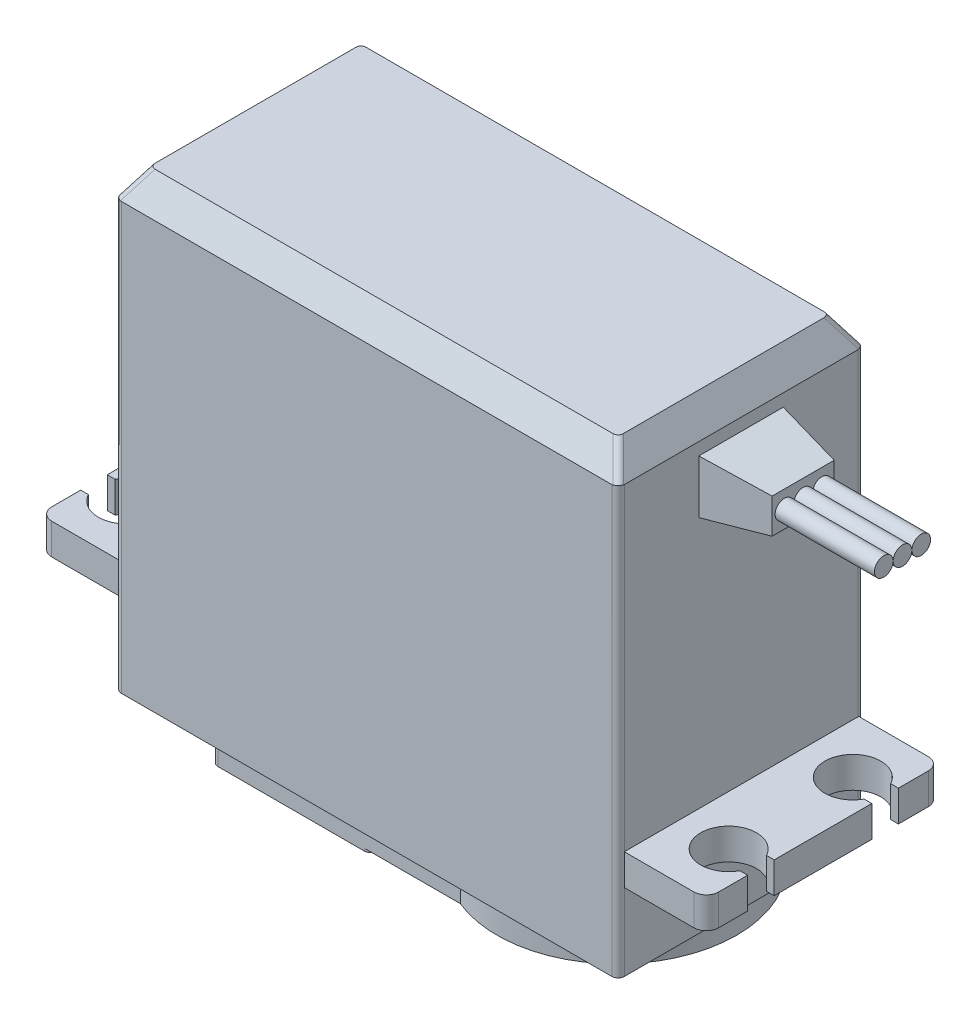
from build123d import *
from OCP.BRepFilletAPI import BRepFilletAPI_MakeChamfer

# Parameters (mm, degrees)
SKETCH_1_W       = 40.5
SKETCH_1_H       = 19.8
BODY_DEPTH       = 36.5
CHAMFER_1_SIZE   = 2.2
CHAMFER_1_SIZE2  = 1.4
FILLET_1_R       = 0.5
MOUNT_DEPTH      = 2.5
FILLET_3_R       = 1
EXTRUDE_3_DEPTH  = 0.5
EXTRUDE_4_DEPTH  = 2
SKETCH_5_W       = 10.8
SKETCH_5_H       = 15.84
EXTRUDE_5_DEPTH  = 0.2
SKETCH_6_R       = 6.6
EXTRUDE_6_DEPTH  = 1.2
SKETCH_7_R       = 5.35
EXTRUDE_7_DEPTH  = 0.5
SKETCH_8_R       = 2.6
SHAFT_HOLE_DEPTH = 10
FILLET_2_R       = 0.5
SKETCH_11_R      = 0.75
EXTRUDE_10_DEPTH = 8


with BuildPart() as part:
    # Эскиз1 → Body (new body)
    with BuildSketch(Plane(origin=(0, 0, 0), x_dir=(1, 0, 0), z_dir=(0, 1, 0))):
        Rectangle(SKETCH_1_W, SKETCH_1_H)
    extrude(amount=BODY_DEPTH)

    # Фаска1: one chamfer whose edges measure the first distance from different faces: ONE call of the kernel's chamfer builder (chamfer() names one face for all edges)
    chamfer_1_edges_1 = [part.edges().sort_by_distance(p)[0] for p in [
        (20.25, 36.5, 0),
    ]]
    chamfer_1_side_1 = [part.faces().sort_by_distance(p)[0] for p in [
        (20.25, 18.25, 0),
    ]]
    chamfer_1_edges_2 = [part.edges().sort_by_distance(p)[0] for p in [
        (0, 36.5, -9.9),
    ]]
    chamfer_1_side_2 = [part.faces().sort_by_distance(p)[0] for p in [
        (0, 18.25, -9.9),
    ]]
    chamfer_1_edges_3 = [part.edges().sort_by_distance(p)[0] for p in [
        (-20.25, 36.5, 0),
    ]]
    chamfer_1_side_3 = [part.faces().sort_by_distance(p)[0] for p in [
        (-20.25, 18.25, 0),
    ]]
    chamfer_1_edges_4 = [part.edges().sort_by_distance(p)[0] for p in [
        (0, 36.5, 9.9),
    ]]
    chamfer_1_side_4 = [part.faces().sort_by_distance(p)[0] for p in [
        (0, 18.25, 9.9),
    ]]
    chamfer_1 = BRepFilletAPI_MakeChamfer(part.part.solid().wrapped)
    for e in chamfer_1_edges_1:
        chamfer_1.Add(CHAMFER_1_SIZE, CHAMFER_1_SIZE2, e.wrapped, chamfer_1_side_1[0].wrapped)  # the first distance lies on this face
    for e in chamfer_1_edges_2:
        chamfer_1.Add(CHAMFER_1_SIZE, CHAMFER_1_SIZE2, e.wrapped, chamfer_1_side_2[0].wrapped)  # the first distance lies on this face
    for e in chamfer_1_edges_3:
        chamfer_1.Add(CHAMFER_1_SIZE, CHAMFER_1_SIZE2, e.wrapped, chamfer_1_side_3[0].wrapped)  # the first distance lies on this face
    for e in chamfer_1_edges_4:
        chamfer_1.Add(CHAMFER_1_SIZE, CHAMFER_1_SIZE2, e.wrapped, chamfer_1_side_4[0].wrapped)  # the first distance lies on this face
    add(Compound.cast(chamfer_1.Shape()), mode=Mode.REPLACE)

    # Скругление1
    # the kernel refuses this fillet: 0.5 mm, written as the material it takes off along each edge
    with BuildSketch(Plane(origin=(-20.25, -1.25, 9.9), x_dir=(1, 0, 0), z_dir=(0, 1, 0)), Plane(origin=(-20.25, -1.25, -9.9), x_dir=(0, 0, 1), z_dir=(0, 1, 0))) as fillet_1_piece_1:
        with BuildLine():
            CenterArc((FILLET_1_R, FILLET_1_R), FILLET_1_R, 180, 90)
            Line((0, FILLET_1_R), (0, 0))
            Line((0, 0), (FILLET_1_R, 0))
        make_face()
    extrude(amount=36.8, mode=Mode.SUBTRACT)
    with BuildSketch(Plane(origin=(20.25, -1.25, -9.9), x_dir=(0, 0, 1), z_dir=(0, 1, 0)), Plane(origin=(20.25, -1.25, 9.9), x_dir=(-1, 0, 0), z_dir=(0, 1, 0))) as fillet_1_piece_2:
        with BuildLine():
            CenterArc((FILLET_1_R, -FILLET_1_R), FILLET_1_R, 90, 90)
            Line((0, -FILLET_1_R), (0, 0))
            Line((0, 0), (FILLET_1_R, 0))
        make_face()
    extrude(amount=36.8, mode=Mode.SUBTRACT)
    with BuildSketch(Plane(origin=(20.689497717, 33.609360731, -10.339497717), x_dir=(0.25395078633508533, -0.3990655213836877, 0.8810537485094523), z_dir=(-0.47301616487963943, 0.7433111162394352, 0.47301616487964004)), Plane(origin=(20.689497717, 33.609360731, 10.339497717), x_dir=(-0.8810537485094526, -0.39906552138369156, 0.25395078633507817), z_dir=(-0.47301616487963943, 0.7433111162394352, -0.47301616487964004))) as fillet_1_piece_3:
        with BuildLine():
            CenterArc((FILLET_1_R * 0.743311116239, -FILLET_1_R), FILLET_1_R, 90, 73.247664886)
            Line((-FILLET_1_R * 0.21424849821, -FILLET_1_R * 0.711764705882), (0, 0))
            Line((0, 0), (FILLET_1_R * 0.743311116239, 0))
        make_face()
    extrude(amount=4.818007508, mode=Mode.SUBTRACT)
    with BuildSketch(Plane(origin=(-20.689497717, 33.609360731, -10.339497717), x_dir=(-0.25395078633507856, -0.3990655213836921, 0.8810537485094524), z_dir=(0.47301616487963943, 0.7433111162394352, 0.47301616487964004)), Plane(origin=(-20.689497717, 33.609360731, 10.339497717), x_dir=(0.8810537485094527, -0.3990655213836916, 0.25395078633507817), z_dir=(0.47301616487963943, 0.7433111162394352, -0.47301616487964004))) as fillet_1_piece_4:
        with BuildLine():
            CenterArc((FILLET_1_R * 0.743311116239, FILLET_1_R), FILLET_1_R, 196.752335114, 73.247664886)
            Line((-FILLET_1_R * 0.21424849821, FILLET_1_R * 0.711764705882), (0, 0))
            Line((0, 0), (FILLET_1_R * 0.743311116239, 0))
        make_face()
    extrude(amount=4.818007508, mode=Mode.SUBTRACT)

    # Эскиз2 → Mount (add)
    with BuildSketch(Plane(origin=(0, 6.2, 0), x_dir=(-1, 0, 0), z_dir=(0, -1, 0))):
        with BuildLine():
            Line((-26.85, 9.472835762), (26.85, 9.472835762))
            Line((26.85, 9.472835762), (26.85, 6.069767442))
            Line((26.85, 6.069767442), (26.229418506, 6.069767442))
            ThreePointArc((26.229418506, 6.069767442), (22, 5), (26.229418506, 3.930232558))
            Line((26.229418506, 3.930232558), (26.85, 3.930232558))
            Line((26.85, 3.930232558), (26.85, -3.930232558))
            Line((26.85, -3.930232558), (26.229418506, -3.930232558))
            ThreePointArc((26.229418506, -3.930232558), (22, -5), (26.229418506, -6.069767442))
            Line((26.229418506, -6.069767442), (26.85, -6.069767442))
            Line((26.85, -6.069767442), (26.85, -9.4))
            Line((26.85, -9.4), (-26.85, -9.4))
            Line((-26.85, -9.4), (-26.85, -6.069767442))
            Line((-26.85, -6.069767442), (-26.229418506, -6.069767442))
            ThreePointArc((-26.229418506, -6.069767442), (-22, -5), (-26.229418506, -3.930232558))
            Line((-26.229418506, -3.930232558), (-26.85, -3.930232558))
            Line((-26.85, -3.930232558), (-26.85, 3.930232558))
            Line((-26.85, 3.930232558), (-26.229418506, 3.930232558))
            ThreePointArc((-26.229418506, 3.930232558), (-22, 5), (-26.229418506, 6.069767442))
            Line((-26.229418506, 6.069767442), (-26.85, 6.069767442))
            Line((-26.85, 6.069767442), (-26.85, 9.472835762))
        make_face()
    extrude(amount=-MOUNT_DEPTH)

    # Скругление3
    fillet_3_edges = [part.edges().sort_by_distance(p)[0] for p in [
        (-26.85, 7.45, 9.4),
        (26.85, 7.45, 9.4),
        (26.85, 7.45, -9.472835762),
        (-26.85, 7.45, -9.472835762),
    ]]
    fillet(fillet_3_edges, radius=FILLET_3_R)

    # Эскиз3 → Бобышка-Вытянуть3 (add, symmetric)
    with BuildSketch(Plane.XY):
        Polygon((-26.85, 6.2), (-20.25, 6.2), (-20.25, 5.2), align=None)
        Polygon((20.25, 5.2), (26.85, 6.2), (20.25, 6.2), align=None)
    extrude(amount=EXTRUDE_3_DEPTH, both=True)

    # Эскиз4 → Бобышка-Вытянуть4 (add)
    with BuildSketch(Plane.XZ):
        with BuildLine():
            Line((-13.452560024, -8.92), (-13.452560024, -4.6))
            ThreePointArc((-13.452560024, -4.6), (-16.49296823, 0), (-13.452560024, 4.6))
            Line((-13.452560024, 4.6), (-13.452560024, 8.92))
            Line((-13.452560024, 8.92), (6.568139057, 8.92))
            ThreePointArc((6.568139057, 8.92), (19.9, 0), (6.568139057, -8.92))
            Line((6.568139057, -8.92), (-13.452560024, -8.92))
        make_face()
    extrude(amount=EXTRUDE_4_DEPTH)

    # Эскиз5 → Бобышка-Вытянуть5 (add)
    with BuildSketch(Plane.XZ.offset(2)):
        with BuildLine():
            Line((-13.452560024, 8.92), (-0.652560024, 8.92))
            Line((-0.652560024, 8.92), (-0.652560024, 2))
            ThreePointArc((-0.652560024, 2), (1.347439976, 0), (-0.652560024, -2))
            Line((-0.652560024, -2), (-0.652560024, -8.92))
            Line((-0.652560024, -8.92), (-13.452560024, -8.92))
            Line((-13.452560024, -8.92), (-13.452560024, 8.92))
        make_face()
        with Locations((-7.052560024, 0)):
            Rectangle(SKETCH_5_W, SKETCH_5_H, mode=Mode.SUBTRACT)
    extrude(amount=EXTRUDE_5_DEPTH)

    # Эскиз6 → Бобышка-Вытянуть6 (add)
    with BuildSketch(Plane.XZ.offset(2)):
        with Locations(Location((10.25, 0, 0), (0, 0, 270))):
            Circle(SKETCH_6_R)
    extrude(amount=EXTRUDE_6_DEPTH)

    # Эскиз7 → Бобышка-Вытянуть7 (add)
    with BuildSketch(Plane.XZ.offset(3.2)):
        with Locations(Location((10.25, 0, 0), (0, 0, 270))):
            Circle(SKETCH_7_R)
    extrude(amount=EXTRUDE_7_DEPTH)

    # Эскиз8 → Shaft hole (cut)
    with BuildSketch(Plane.XZ.offset(3.7)):
        with Locations(Location((10.25, 0, 0), (0, 0, 270))):
            Circle(SKETCH_8_R)
    extrude(amount=-SHAFT_HOLE_DEPTH, mode=Mode.SUBTRACT)

    # Скругление2
    fillet_2_edges = [part.edges().sort_by_distance(p)[0] for p in [
        (-13.452560024, -1.1, 8.92),
        (-0.652560024, -2.1, 2),
        (-0.652560024, -2.1, -2),
        (-0.652560024, -2.1, 8.92),
        (-0.652560024, -2.1, -8.92),
        (-13.452560024, -1.1, -8.92),
        (-1.652560024, -2.1, 7.92),
        (-1.652560024, -2.1, -7.92),
        (-12.452560024, -2.1, 7.92),
        (-12.452560024, -2.1, -7.92),
    ]]
    fillet(fillet_2_edges, radius=FILLET_2_R)

    # Эскиз10 → Rubber section 0
    with BuildSketch(Plane(origin=(25.25, 0, 0), x_dir=(0, 0, -1), z_dir=(1, 0, 0))):
        with BuildLine():
            Line((-2.5, 29.75), (2.5, 29.75))
            Line((2.5, 29.75), (2.5, 32.55))
            Line((2.5, 32.55), (-2.5, 32.55))
            Line((-2.5, 32.55), (-2.5, 29.75))
        make_face()
    # Эскиз9 → Rubber section 1
    with BuildSketch(Plane(origin=(20.25, 0, 0), x_dir=(0, 0, -1), z_dir=(1, 0, 0))):
        with BuildLine():
            Line((-3.4, 33.3), (3.4, 33.3))
            Line((3.4, 33.3), (3.4, 29))
            Line((3.4, 29), (-3.4, 29))
            Line((-3.4, 29), (-3.4, 33.3))
        make_face()
    loft()

    # Эскиз11 → Бобышка-Вытянуть10 (add)
    with BuildSketch(Plane(origin=(25.25, 0, 0), x_dir=(0, 0, -1), z_dir=(1, 0, 0))):
        with Locations(Location((0, 31.150503064, 0), (0, 0, 180))):
            Circle(SKETCH_11_R)
        with Locations(Location((1.509999917, 31.15000331, 0), (0, 0, 180))):
            Circle(SKETCH_11_R)
        with Locations(Location((-1.509999915, 31.149996646, 0), (0, 0, 180))):
            Circle(SKETCH_11_R)
    extrude(amount=EXTRUDE_10_DEPTH)


solid = part.part
